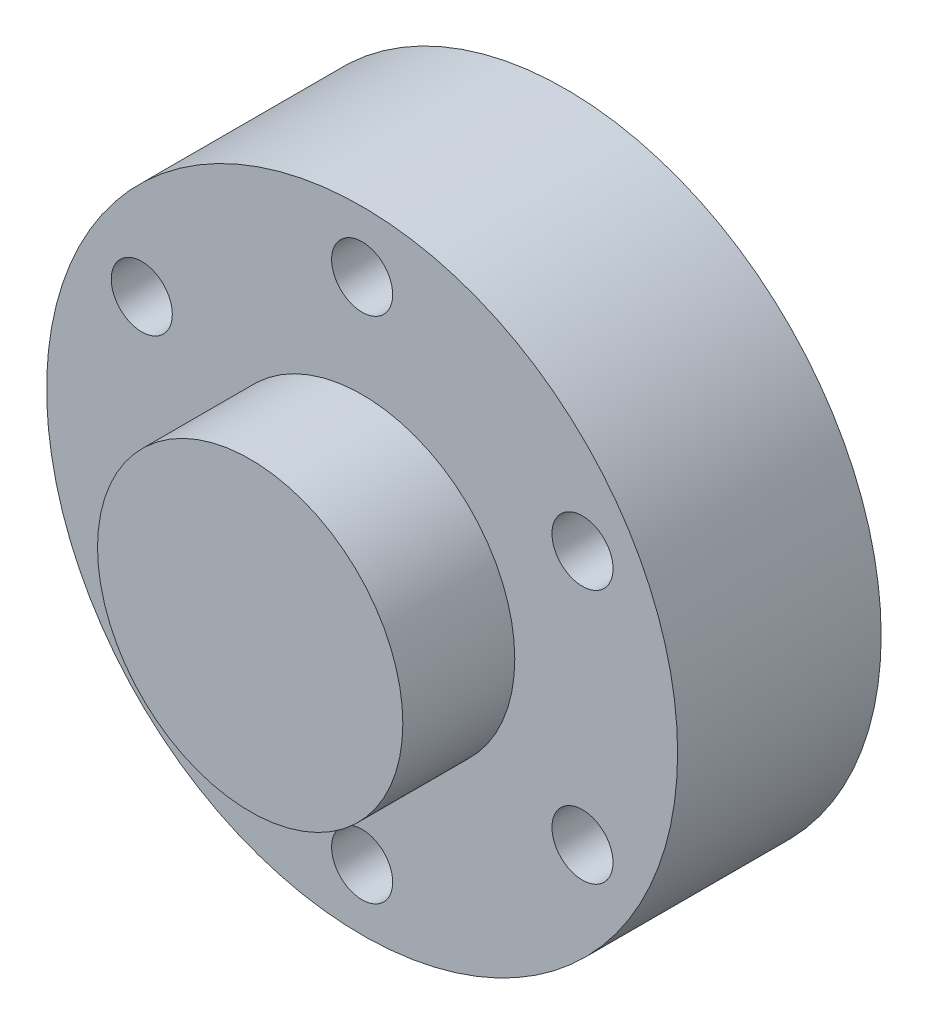
from build123d import *

# Parameters (mm, degrees)
SKETCH2_R           = 15.5
SKETCH2_R_2         = 1.5
BOSS_EXTRUDE1_DEPTH = 10
SKETCH3_R           = 7.5
BOSS_EXTRUDE2_DEPTH = 5.5
BOSS_EXTRUDE4_START = 5.5
SKETCH6_R           = 7.5
BOSS_EXTRUDE4_DEPTH = 5.5
SKETCH7_R           = 2
BOSS_EXTRUDE5_DEPTH = 1
FILLET2_R           = 0.05
CUT_EXTRUDE1_DEPTH  = 11


with BuildPart() as part:
    # Sketch2 → Boss-Extrude1 (new body)
    with BuildSketch(Plane.XY):
        Circle(SKETCH2_R)
        with Locations((0, -12.5)):
            Circle(SKETCH2_R_2, mode=Mode.SUBTRACT)
        with Locations((-10.825317547, -6.25)):
            Circle(SKETCH2_R_2, mode=Mode.SUBTRACT)
        with Locations((10.825317547, -6.25)):
            Circle(SKETCH2_R_2, mode=Mode.SUBTRACT)
        with Locations((-10.825317547, 6.25)):
            Circle(SKETCH2_R_2, mode=Mode.SUBTRACT)
        with Locations((0, 12.5)):
            Circle(SKETCH2_R_2, mode=Mode.SUBTRACT)
        with Locations((10.825317547, 6.25)):
            Circle(SKETCH2_R_2, mode=Mode.SUBTRACT)
    extrude(amount=BOSS_EXTRUDE1_DEPTH)

    # Sketch3 → Boss-Extrude2 (add)
    with BuildSketch(Plane.XY.offset(10)):
        Circle(SKETCH3_R)
    extrude(amount=BOSS_EXTRUDE2_DEPTH)

    # Sketch6 → Boss-Extrude4 (add)
    with BuildSketch(Plane(origin=(0, 0, 0), x_dir=(-1, 0, 0), z_dir=(0, 0, -1)).offset(BOSS_EXTRUDE4_START)):
        Circle(SKETCH6_R)
    extrude(amount=-BOSS_EXTRUDE4_DEPTH)

    # Sketch7 → Boss-Extrude5 (add)
    with BuildSketch(Plane(origin=(0, 0, -5.5), x_dir=(-1, 0, 0), z_dir=(0, 0, -1))):
        Circle(SKETCH7_R)
    extrude(amount=BOSS_EXTRUDE5_DEPTH)

    # Fillet2
    fillet2_edges = [part.edges().sort_by_distance(p)[0] for p in [
        (2, 0, -6.5),
    ]]
    fillet(fillet2_edges, radius=FILLET2_R)

    # Sketch9 → Cut-Extrude1 (cut)
    with BuildSketch(Plane(origin=(0, 0, -6.5), x_dir=(-1, 0, 0), z_dir=(0, 0, -1))):
        with BuildLine():
            Line((-1.224744871, 1.25), (1.224744871, 1.25))
            ThreePointArc((1.224744871, 1.25), (0, -1.75), (-1.224744871, 1.25))
        make_face()
    extrude(amount=-CUT_EXTRUDE1_DEPTH, mode=Mode.SUBTRACT)


solid = part.part
